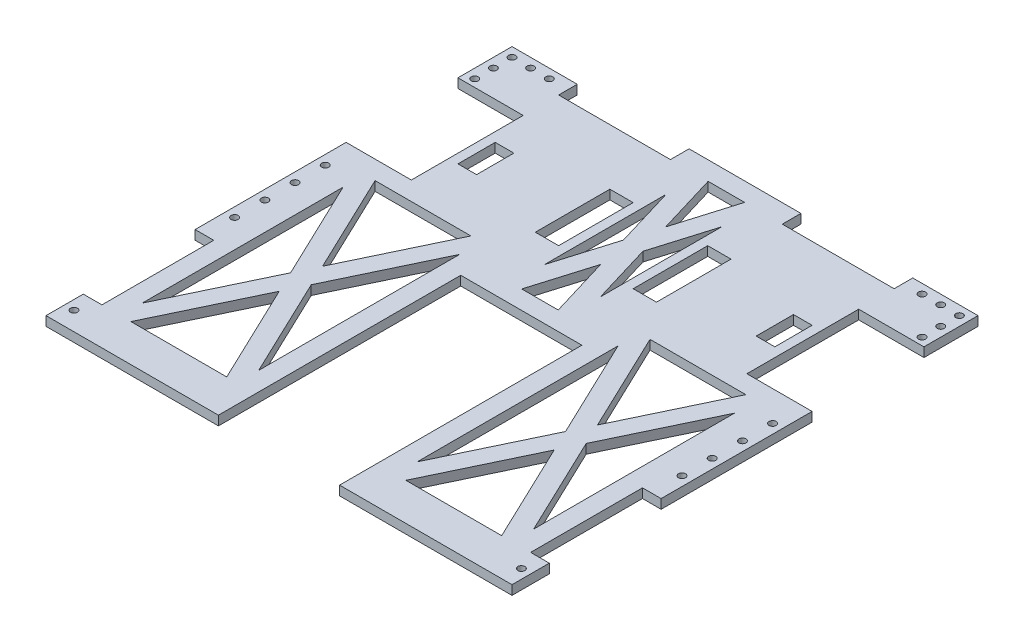
from build123d import *

# Parameters (mm, degrees)
BOSS_EXTRUDE1_DEPTH = 6.35
SKETCH2_W           = 44.45
SKETCH2_H           = 76.2
SKETCH2_W_2         = 12.7
SKETCH2_W_3         = 76.2
SKETCH2_H_2         = 12.7
CUT_EXTRUDE1_DEPTH  = 289.907554418
CUT_EXTRUDE3_DEPTH  = 289.907554418
SKETCH3_W           = 15.875
SKETCH3_H           = 50.8
SKETCH3_W_2         = 12.7
SKETCH3_H_2         = 25.4
CUT_EXTRUDE2_DEPTH  = 289.907554418
CUT_EXTRUDE5_DEPTH  = 289.907554418
SKETCH7_R           = 2.413
CUT_EXTRUDE6_DEPTH  = 289.907554418


with BuildPart() as part:
    # Sketch1 → Boss-Extrude1 (new body)
    with BuildSketch(Plane(origin=(0, 0, 0), x_dir=(1, 0, 0), z_dir=(0, 1, 0))):
        Polygon((-158.75, 76.2), (-158.75, -241.3), (-41.275, -241.3), (-41.275, -76.2), (41.275, -76.2), (41.275, -241.3), (158.75, -241.3), (158.75, 76.2), align=None)
    extrude(amount=BOSS_EXTRUDE1_DEPTH)

    # Sketch2 → Cut-Extrude1 (cut, through all)
    with BuildSketch(Plane(origin=(0, 6.35, 0), x_dir=(1, 0, 0), z_dir=(0, 1, 0))):
        with Locations((136.525, 1.27)):
            Rectangle(SKETCH2_W, SKETCH2_H)
        with Locations((152.4, -177.8)):
            Rectangle(SKETCH2_W_2, SKETCH2_H)
        with Locations((-152.4, -177.8)):
            Rectangle(SKETCH2_W_2, SKETCH2_H)
        with Locations((-136.525, 1.27)):
            Rectangle(SKETCH2_W, SKETCH2_H)
        with Locations((-76.2, 69.85)):
            Rectangle(SKETCH2_W_3, SKETCH2_H_2)
        with Locations((76.2, 69.85)):
            Rectangle(SKETCH2_W_3, SKETCH2_H_2)
    extrude(amount=-CUT_EXTRUDE1_DEPTH, mode=Mode.SUBTRACT)

    # Sketch4 → Cut-Extrude3 (cut, through all)
    with BuildSketch(Plane(origin=(0, 6.35, 0), x_dir=(1, 0, 0), z_dir=(0, 1, 0))):
        Polygon((93.6625, -147.46179464), (61.010684466, -215.9), (126.314315534, -215.9), align=None)
        Polygon((53.975, -64.27679464), (53.975, -201.15320536), (86.626815534, -132.715), align=None)
        Polygon((133.35, -64.27679464), (100.698184466, -132.715), (133.35, -201.15320536), align=None)
        Polygon((61.010684466, -49.53), (93.6625, -117.96820536), (126.314315534, -49.53), align=None)
        Polygon((-86.626815534, -132.715), (-53.975, -201.15320536), (-53.975, -64.27679464), align=None)
        Polygon((-126.314315534, -49.53), (-93.6625, -117.96820536), (-61.010684466, -49.53), align=None)
        Polygon((-61.010684466, -215.9), (-93.6625, -147.46179464), (-126.314315534, -215.9), align=None)
        Polygon((-133.35, -201.15320536), (-100.698184466, -132.715), (-133.35, -64.27679464), align=None)
    extrude(amount=-CUT_EXTRUDE3_DEPTH, mode=Mode.SUBTRACT)

    # Sketch3 → Cut-Extrude2 (cut, through all)
    with BuildSketch(Plane(origin=(0, 6.35, 0), x_dir=(1, 0, 0), z_dir=(0, 1, 0))):
        with Locations((-33.3375, 0)):
            Rectangle(SKETCH3_W, SKETCH3_H)
        with Locations((33.3375, 0)):
            Rectangle(SKETCH3_W, SKETCH3_H)
        with Locations((101.6, 1.27)):
            Rectangle(SKETCH3_W_2, SKETCH3_H_2)
        with Locations((-101.6, 1.27)):
            Rectangle(SKETCH3_W_2, SKETCH3_H_2)
    extrude(amount=-CUT_EXTRUDE2_DEPTH, mode=Mode.SUBTRACT)

    # Sketch6 → Cut-Extrude5 (cut, through all)
    with BuildSketch(Plane(origin=(0, 6.35, 0), x_dir=(1, 0, 0), z_dir=(0, 1, 0))):
        Polygon((12.420405367, 63.5), (-12.420405367, 63.5), (0, 22.098648777), align=None)
        Polygon((-6.629594633, 0), (-19.05, 41.401351223), (-19.05, -41.401351223), align=None)
        Polygon((19.05, 41.401351223), (6.629594633, 0), (19.05, -41.401351223), align=None)
        Polygon((12.420405367, -63.5), (0, -22.098648777), (-12.420405367, -63.5), align=None)
    extrude(amount=-CUT_EXTRUDE5_DEPTH, mode=Mode.SUBTRACT)

    # Sketch7 → Cut-Extrude6 (cut, through all)
    with BuildSketch(Plane(origin=(0, 6.35, 0), x_dir=(1, 0, 0), z_dir=(0, 1, 0))):
        with Locations((152.4, -119.126)):
            Circle(SKETCH7_R)
        with Locations((152.4, -98.552)):
            Circle(SKETCH7_R)
        with Locations((152.4, -77.978)):
            Circle(SKETCH7_R)
        with Locations((152.4, -57.404)):
            Circle(SKETCH7_R)
        with Locations((-152.4, -57.404)):
            Circle(SKETCH7_R)
        with Locations((-152.4, -77.978)):
            Circle(SKETCH7_R)
        with Locations((-152.4, -98.552)):
            Circle(SKETCH7_R)
        with Locations((-152.4, -119.126)):
            Circle(SKETCH7_R)
        with Locations((152.4, -228.6)):
            Circle(SKETCH7_R)
        with Locations((152.4, 69.85)):
            Circle(SKETCH7_R)
        with Locations((139.7, 69.85)):
            Circle(SKETCH7_R)
        with Locations((127, 69.85)):
            Circle(SKETCH7_R)
        with Locations((152.4, 57.15)):
            Circle(SKETCH7_R)
        with Locations((152.4, 44.45)):
            Circle(SKETCH7_R)
        with Locations((-152.4, 44.45)):
            Circle(SKETCH7_R)
        with Locations((-152.4, 57.15)):
            Circle(SKETCH7_R)
        with Locations((-127, 69.85)):
            Circle(SKETCH7_R)
        with Locations((-139.7, 69.85)):
            Circle(SKETCH7_R)
        with Locations((-152.4, 69.85)):
            Circle(SKETCH7_R)
        with Locations((-152.4, -228.6)):
            Circle(SKETCH7_R)
    extrude(amount=-CUT_EXTRUDE6_DEPTH, mode=Mode.SUBTRACT)


solid = part.part
